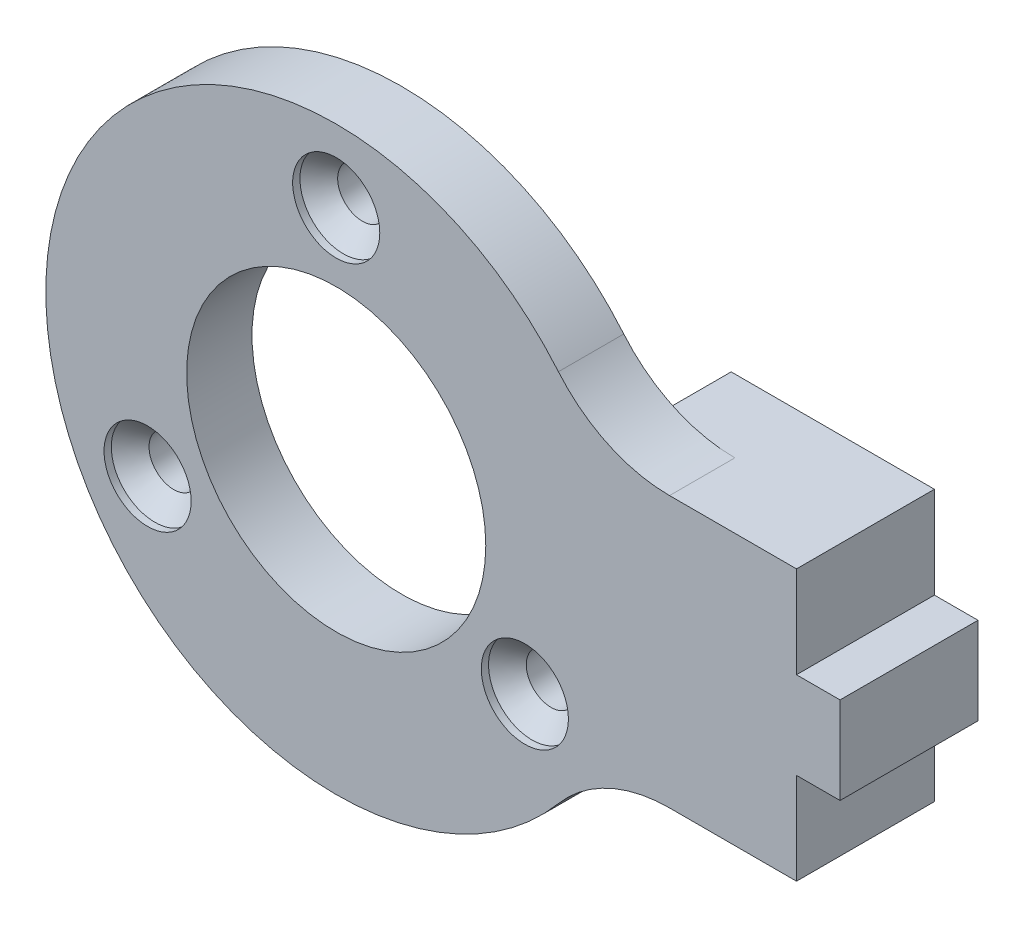
from build123d import *

# Parameters (mm, degrees)
CROQUIS1_R              = 10.3
CROQUIS1_R_2            = 1.7
SALIENTE_EXTRUIR1_DEPTH = 4.5
CROQUIS4_R              = 3
CORTAR_EXTRUIR2_DEPTH   = 2
CHAFL_N2_SIZE           = 1.5
SALIENTE_EXTRUIR2_DEPTH = 3
SALIENTE_EXTRUIR3_DEPTH = 5
CROQUIS8_R              = 20
CORTAR_EXTRUIR3_DEPTH   = 5
REDONDEO1_R             = 10


with BuildPart() as part:
    # Croquis1 → Saliente-Extruir1 (new body)
    with BuildSketch(Plane.XY):
        with BuildLine():
            Line((17.698364448, 9.314928657), (31.698364448, 9.314928657))
            Line((31.698364448, 9.314928657), (31.698364448, -9.314928657))
            Line((31.698364448, -9.314928657), (17.698364448, -9.314928657))
            ThreePointArc((17.698364448, -9.314928657), (-20, 0), (17.698364448, 9.314928657))
        make_face()
        Circle(CROQUIS1_R, mode=Mode.SUBTRACT)
        with Locations((12.990381057, -7.5)):
            Circle(CROQUIS1_R_2, mode=Mode.SUBTRACT)
        with Locations((0, 15)):
            Circle(CROQUIS1_R_2, mode=Mode.SUBTRACT)
        with Locations((-12.990381057, -7.5)):
            Circle(CROQUIS1_R_2, mode=Mode.SUBTRACT)
    extrude(amount=SALIENTE_EXTRUIR1_DEPTH)

    # Croquis4 → Cortar-Extruir2 (cut)
    with BuildSketch(Plane.XY.offset(4.5)):
        with Locations((0, 15)):
            Circle(CROQUIS4_R)
        with Locations((12.990381057, -7.5)):
            Circle(CROQUIS4_R)
        with Locations((-12.990381057, -7.5)):
            Circle(CROQUIS4_R)
    extrude(amount=-CORTAR_EXTRUIR2_DEPTH, mode=Mode.SUBTRACT)

    # Chaflán2
    # the kernel refuses this chamfer: 1.5 mm, written as the material it adds along each edge
    with BuildSketch(Plane(origin=(12.990381057, -7.5, 2.5), x_dir=(1, 0, 0), z_dir=(0, -1, 0))) as chafl_n2_piece_1_section:
        Polygon((3, CHAFL_N2_SIZE), (3 - CHAFL_N2_SIZE, 0), (3, 0), align=None)
    chafl_n2_piece_1 = revolve(axis=Axis((12.990381057, -7.5, 2.5), (0, 0, 1)), mode=Mode.PRIVATE)
    chafl_n2_piece_1 = chafl_n2_piece_1 - Plane(origin=(12.990381057, -7.5, 3.352298642), x_dir=(1, 0, 0), z_dir=(0, 0, -1)) * Cylinder(1.7, 13, mode=Mode.PRIVATE)
    add(chafl_n2_piece_1)
    with BuildSketch(Plane(origin=(0, 15, 2.5), x_dir=(1, 0, 0), z_dir=(0, -1, 0))) as chafl_n2_piece_2_section:
        Polygon((3, CHAFL_N2_SIZE), (3 - CHAFL_N2_SIZE, 0), (3, 0), align=None)
    chafl_n2_piece_2 = revolve(axis=Axis((0, 15, 2.5), (0, 0, 1)), mode=Mode.PRIVATE)
    chafl_n2_piece_2 = chafl_n2_piece_2 - Plane(origin=(0, 15, 3.352298642), x_dir=(1, 0, 0), z_dir=(0, 0, -1)) * Cylinder(1.7, 12, mode=Mode.PRIVATE)
    add(chafl_n2_piece_2)
    with BuildSketch(Plane(origin=(-12.990381057, -7.5, 2.5), x_dir=(1, 0, 0), z_dir=(0, -1, 0))) as chafl_n2_piece_3_section:
        Polygon((3, CHAFL_N2_SIZE), (3 - CHAFL_N2_SIZE, 0), (3, 0), align=None)
    chafl_n2_piece_3 = revolve(axis=Axis((-12.990381057, -7.5, 2.5), (0, 0, 1)), mode=Mode.PRIVATE)
    chafl_n2_piece_3 = chafl_n2_piece_3 - Plane(origin=(-12.990381057, -7.5, 3.352298642), x_dir=(1, 0, 0), z_dir=(0, 0, -1)) * Cylinder(1.7, 13, mode=Mode.PRIVATE)
    add(chafl_n2_piece_3)

    # Croquis6 → Saliente-Extruir2 (add)
    with BuildSketch(Plane(origin=(31.698364448, 0, 0), x_dir=(0, 0, -1), z_dir=(1, 0, 0))):
        Polygon((-4.5, 0), (-4.5, 3), (0, 3), (0, -3), (-4.5, -3), align=None)
    extrude(amount=SALIENTE_EXTRUIR2_DEPTH)

    # Croquis7 → Saliente-Extruir3 (add)
    with BuildSketch(Plane(origin=(0, 0, 0), x_dir=(-1, 0, 0), z_dir=(0, 0, -1))):
        Polygon((-17.698364448, -9.314928657), (-31.698364448, -9.314928657), (-31.698364448, -3), (-34.698364448, -3), (-34.698364448, 3), (-31.698364448, 3), (-31.698364448, 9.314928657), (-17.698364448, 9.314928657), align=None)
    extrude(amount=SALIENTE_EXTRUIR3_DEPTH)

    # Croquis8 → Cortar-Extruir3 (cut)
    with BuildSketch(Plane(origin=(0, 0, -5), x_dir=(-1, 0, 0), z_dir=(0, 0, -1))):
        Circle(CROQUIS8_R)
    extrude(amount=-CORTAR_EXTRUIR3_DEPTH, mode=Mode.SUBTRACT)

    # Redondeo1
    # the kernel refuses this fillet: 10 mm, written as the material it adds along each edge
    with BuildSketch(Plane(origin=(17.698364448, 9.314928657, 0), x_dir=(-0.5580103389046711, 0.829833996456818, 0), z_dir=(0, 0, 1))) as redondeo1_piece_1:
        with BuildLine():
            CenterArc((5.365064674, -9.942265498), REDONDEO1_R, 96.159770197, 49.921919005)
            Line((-2.933275291, -4.362162109), (0, 0))
            ThreePointArc((0, 0), (2.14602587, -0.115469003), (4.292051739, 0))
        make_face()
    extrude(amount=4.5)
    with BuildSketch(Plane(origin=(17.698364448, -9.314928657, 0), x_dir=(1, 0, 0), z_dir=(0, 0, 1))) as redondeo1_piece_2:
        with BuildLine():
            CenterArc((5.256668355, -10), REDONDEO1_R, 90, 49.921919005)
            ThreePointArc((-2.395009246, -3.561690448), (-1.101684519, -1.845278121), (0, 0))
            Line((0, 0), (5.256668355, 0))
        make_face()
    extrude(amount=4.5)


solid = part.part
